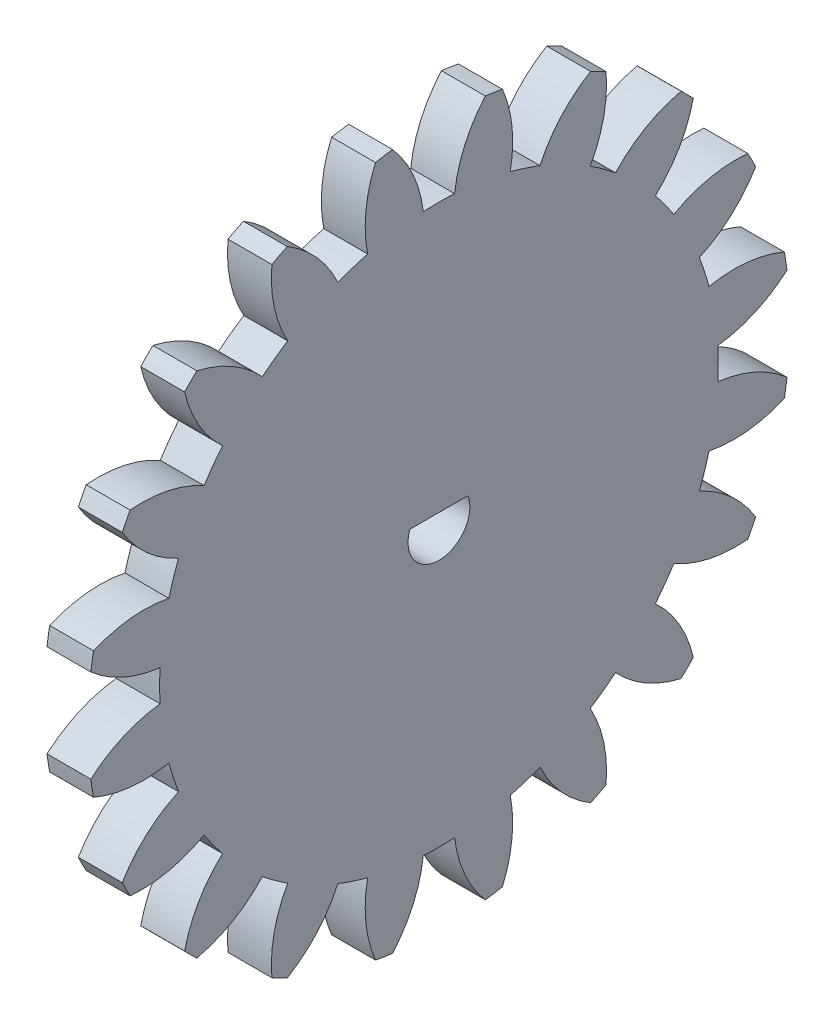
from build123d import *

# Parameters (mm, degrees)
BASPROSKE_W           = 5.5
BASPROSKE_H           = 44
TOOTHCUT_DEPTH        = 63.467991804
TEETHCUTS_COUNT       = 20
TEETHCUTS_ANGLE       = 342
BORSKE_R              = 0.5
BORE_DEPTH            = 50.0000508
CORTAR_EXTRUIR1_DEPTH = 5.5


with BuildPart() as part:
    # BasProSke → Base-Revolve (revolve)
    with BuildSketch(Plane(origin=(0, 0, 0), x_dir=(1, 0, 0), z_dir=(0, 1, 0))):
        with Locations((2.75, 22)):
            Rectangle(BASPROSKE_W, BASPROSKE_H)
    revolve(axis=Axis((-10, 0, 0), (1, 0, 0)))

    # TooCutSke → ToothCut (cut, through all)
    with BuildSketch(Plane(origin=(0, 0, 0), x_dir=(0, 0, -1), z_dir=(1, 0, 0))):
        with BuildLine():
            ThreePointArc((1.961730392, 34.943978235), (0, 34.999), (-1.961730392, 34.943978235))
            ThreePointArc((-1.961730392, 34.943978235), (-3.235659864, 39.585086827), (-5.832115241, 43.637395396))
            ThreePointArc((-5.832115241, 43.637395396), (0, 44.0254), (5.832115241, 43.637395396))
            ThreePointArc((5.832115241, 43.637395396), (3.235659864, 39.585086827), (1.961730392, 34.943978235))
        make_face()
    toothcut = extrude(amount=TOOTHCUT_DEPTH, mode=Mode.SUBTRACT)

    # TeethCuts: ToothCut ×20 about axis
    teethcuts_axis = Axis((-10, 0, 0), (1, 0, 0))
    for i in range(1, TEETHCUTS_COUNT):
        add(toothcut.rotate(teethcuts_axis, i * TEETHCUTS_ANGLE / (TEETHCUTS_COUNT - 1)), mode=Mode.SUBTRACT)

    # BorSke → Bore (cut, symmetric)
    with BuildSketch(Plane(origin=(0, 0, 0), x_dir=(0, 0, -1), z_dir=(1, 0, 0))):
        Circle(BORSKE_R)
    extrude(amount=BORE_DEPTH, both=True, mode=Mode.SUBTRACT)

    # Croquis1 → Cortar-Extruir1 (cut)
    with BuildSketch(Plane(origin=(5.5, 0, 0), x_dir=(0, 0, -1), z_dir=(1, 0, 0))):
        with BuildLine():
            Line((0, 1.325), (3.641428291, 1.325))
            ThreePointArc((3.641428291, 1.325), (3.81616035, 0.672714788), (3.875, 0))
            ThreePointArc((3.875, 0), (0, -3.875), (-3.875, 0))
            ThreePointArc((-3.875, 0), (-3.81616035, 0.672714788), (-3.641428291, 1.325))
            Line((-3.641428291, 1.325), (0, 1.325))
        make_face()
    extrude(amount=-CORTAR_EXTRUIR1_DEPTH, mode=Mode.SUBTRACT)


solid = part.part
